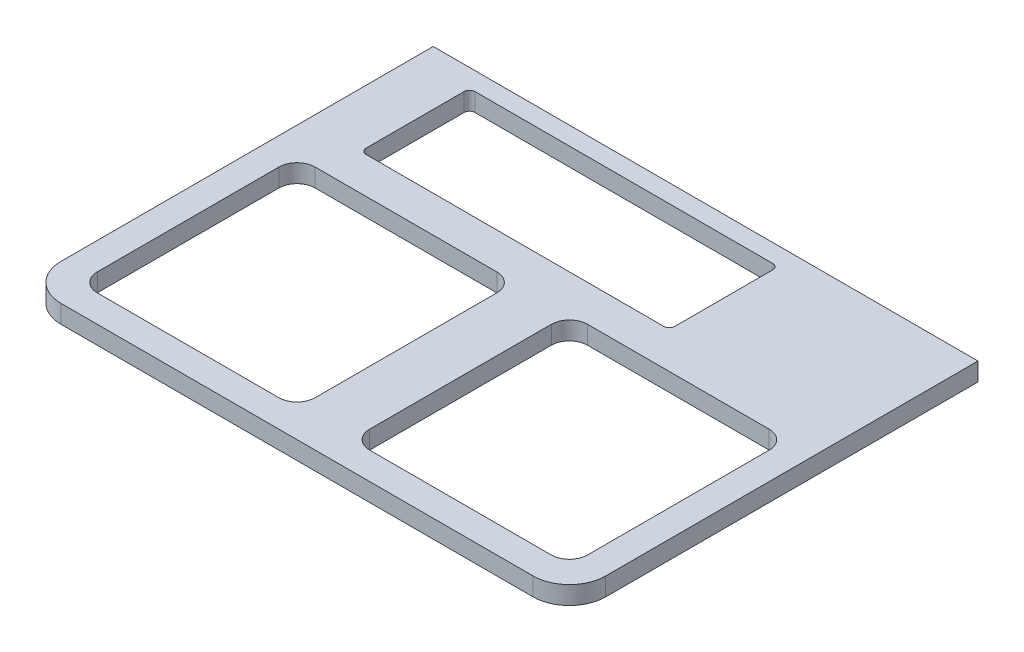
from build123d import *

# Parameters (mm, degrees)
SKIZZE1_W                       = 120
SKIZZE1_H                       = 120
LINEAR_AUSTRAGEN1_DEPTH         = 10
VERRUNDUNG2_R                   = 10
VERRUNDUNG2_OF_SPIEGELN1_R      = 10
SKIZZE3_W                       = 170
SKIZZE3_H                       = 60
SCHNITT_LINEAR_AUSTRAGEN1_DEPTH = 10
VERRUNDUNG3_R                   = 3


with BuildPart() as part:
    # Skizze1 → Linear austragen1 (new body)
    with BuildSketch(Plane(origin=(0, 10, 0), x_dir=(1, 0, 0), z_dir=(0, 1, 0))):
        with BuildLine():
            Line((0, -75), (130, -75))
            ThreePointArc((130, -75), (144.142135624, -69.142135624), (150, -55))
            Line((150, -55), (150, 75))
            Line((150, 75), (150, 150))
            Line((150, 150), (0, 150))
            Line((0, 150), (0, 75))
            Line((0, 75), (0, -75))
        make_face()
        with Locations((75, 0)):
            Rectangle(SKIZZE1_W, SKIZZE1_H, mode=Mode.SUBTRACT)
    linear_austragen1 = extrude(amount=LINEAR_AUSTRAGEN1_DEPTH)

    # Verrundung2
    verrundung2_edges = [part.edges().sort_by_distance(p)[0] for p in [
        (15, 15, 60),
        (135, 15, 60),
        (135, 15, -60),
        (15, 15, -60),
    ]]
    fillet(verrundung2_edges, radius=VERRUNDUNG2_R)

    # Spiegeln1: Linear austragen1 across plane
    add(linear_austragen1.mirror(Plane(origin=(0, 20, -150), x_dir=(0, 0, 1), z_dir=(1, 0, 0))))

    # Verrundung2 of Spiegeln1
    verrundung2_of_spiegeln1_edges = [part.edges().sort_by_distance(p)[0] for p in [
        (-15, 15, 60),
        (-135, 15, 60),
        (-135, 15, -60),
        (-15, 15, -60),
    ]]
    fillet(verrundung2_of_spiegeln1_edges, radius=VERRUNDUNG2_OF_SPIEGELN1_R)

    # Skizze3 → Schnitt-Linear austragen1 (cut)
    with BuildSketch(Plane.XZ.offset(-10)):
        with Locations((-35, -110)):
            Rectangle(SKIZZE3_W, SKIZZE3_H)
    extrude(amount=-SCHNITT_LINEAR_AUSTRAGEN1_DEPTH, mode=Mode.SUBTRACT)

    # Verrundung3
    verrundung3_edges = [part.edges().sort_by_distance(p)[0] for p in [
        (-120, 15, -140),
        (50, 15, -140),
        (50, 15, -80),
        (-120, 15, -80),
    ]]
    fillet(verrundung3_edges, radius=VERRUNDUNG3_R)


solid = part.part
